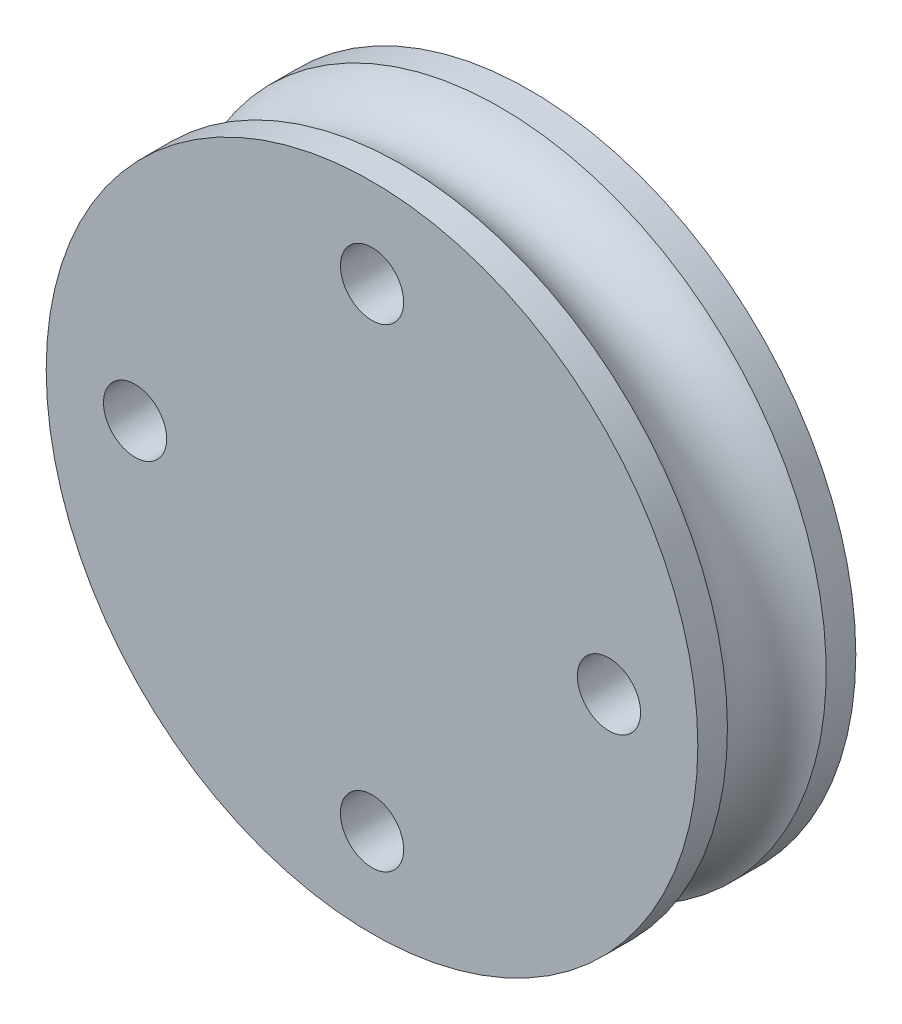
from build123d import *
from OCP.BRepAlgoAPI import BRepAlgoAPI_Cut
from OCP.TopTools import TopTools_ListOfShape

# Parameters (mm, degrees)
SKIZZE2_R                       = 8.25
SKIZZE2_R_2                     = 0.8
AUFSATZ_LINEAR_AUSTRAGEN1_DEPTH = 4


with BuildPart() as part:
    # Skizze2 → Aufsatz-Linear austragen1 (new body)
    with BuildSketch(Plane.XY):
        with Locations((-1.64e-06, -6.336e-06)):
            Circle(SKIZZE2_R)
        with Locations((6.000570744, 0.000379921)):
            Circle(SKIZZE2_R_2, mode=Mode.SUBTRACT)
        with Locations((0.000570744, 6.000379921)):
            Circle(SKIZZE2_R_2, mode=Mode.SUBTRACT)
        with Locations((-5.999429256, 0.000379921)):
            Circle(SKIZZE2_R_2, mode=Mode.SUBTRACT)
        with Locations((0.000570744, -5.999620079)):
            Circle(SKIZZE2_R_2, mode=Mode.SUBTRACT)
    extrude(amount=AUFSATZ_LINEAR_AUSTRAGEN1_DEPTH)


with BuildPart() as schnitt_rotation4_tool:
    # Skizze5 → Schnitt-Rotation4 (revolve)
    with BuildSketch(Plane(origin=(0, 0, 0), x_dir=(0, 0, -1), z_dir=(1, 0, 0))):
        with BuildLine():
            Line((-3.25, 8.249993664), (-0.75, 8.249993664))
            ThreePointArc((-0.75, 8.249993664), (-2, 7.480469675), (-3.25, 8.249993664))
        make_face()
    revolve(axis=Axis((0, 0, 2), (0, 0, 1)))


with BuildPart() as part_1:
    add(part.part)

    # Schnitt-Rotation4: cut by schnitt_rotation4_tool, with a tolerance
    schnitt_rotation4_stock = TopTools_ListOfShape()
    schnitt_rotation4_stock.Append(part_1.part.wrapped)
    schnitt_rotation4_tools = TopTools_ListOfShape()
    schnitt_rotation4_tools.Append(schnitt_rotation4_tool.part.wrapped)
    schnitt_rotation4_cut = BRepAlgoAPI_Cut()
    schnitt_rotation4_cut.SetArguments(schnitt_rotation4_stock)
    schnitt_rotation4_cut.SetTools(schnitt_rotation4_tools)
    schnitt_rotation4_cut.SetFuzzyValue(0.00001)
    schnitt_rotation4_cut.Build()
    add(Compound.cast(schnitt_rotation4_cut.Shape()).solids(), mode=Mode.REPLACE)


solid = part_1.part
